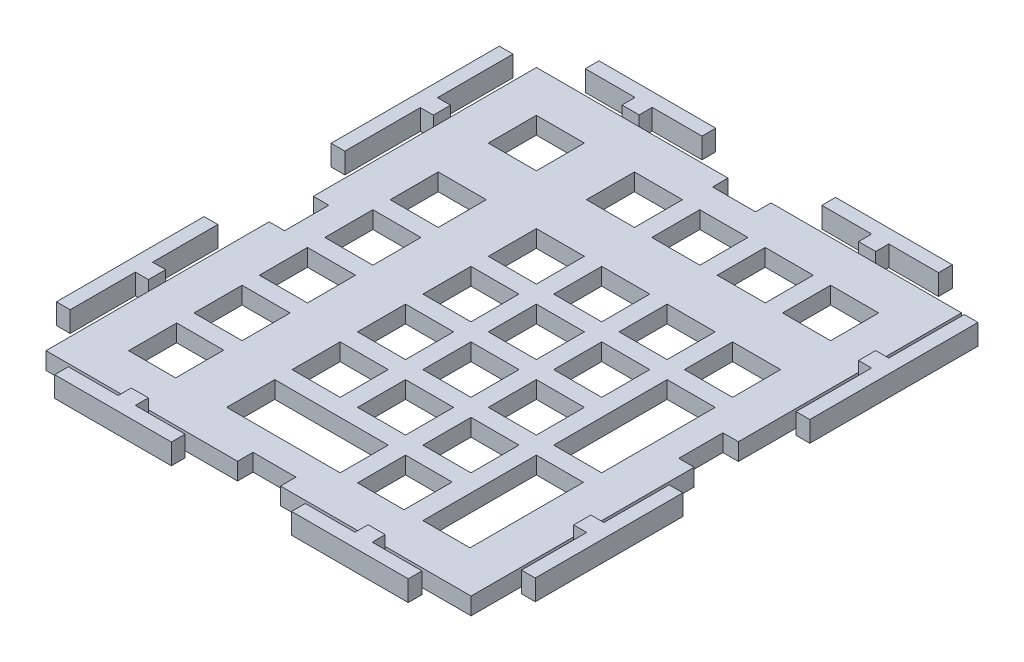
from build123d import *

# Parameters (mm, degrees)
SKETCH2_W           = 14
SKETCH2_H           = 14
SKETCH2_H_2         = 33.05
SKETCH2_W_2         = 13.729566143
SKETCH2_W_3         = 13.70712796
SKETCH2_W_4         = 33.05
SKETCH2_W_5         = 13.572021081
BOSS_EXTRUDE1_DEPTH = 5
SKETCH4_W           = 12.525
SKETCH4_H           = 4.5
SKETCH4_W_2         = 4.5
SKETCH4_H_2         = 12.875
CUT_EXTRUDE1_DEPTH  = 105.356725069
BOSS_EXTRUDE2_DEPTH = 3


with BuildPart() as part:
    # Sketch2 → Boss-Extrude1 (new body)
    with BuildSketch(Plane(origin=(0, 0, 0), x_dir=(1, 0, 0), z_dir=(0, 1, 0))):
        Polygon((-50.855969028, -62.044409949), (43.049030972, -62.044409949), (58.009030972, -62.044409949), (58.009030972, -47.084409949), (58.009030972, 65.870590051), (58.009030972, 80.830590051), (43.049030972, 80.830590051), (-50.855969028, 80.830590051), (-65.815969028, 80.830590051), (-65.815969028, 65.870590051), (-65.815969028, -47.084409949), (-65.815969028, -62.044409949), align=None)
        with Locations((38.959030972, 61.745590051)):
            Rectangle(SKETCH2_W, SKETCH2_H, mode=Mode.SUBTRACT)
        with Locations((19.909030972, 61.745590051)):
            Rectangle(SKETCH2_W, SKETCH2_H, mode=Mode.SUBTRACT)
        with Locations((0.859030972, 61.745590051)):
            Rectangle(SKETCH2_W, SKETCH2_H, mode=Mode.SUBTRACT)
        with Locations((-18.190969028, 61.745590051)):
            Rectangle(SKETCH2_W, SKETCH2_H, mode=Mode.SUBTRACT)
        with Locations((38.959030972, 33.170590051)):
            Rectangle(SKETCH2_W, SKETCH2_H, mode=Mode.SUBTRACT)
        with Locations((-46.765969028, 61.745590051)):
            Rectangle(SKETCH2_W, SKETCH2_H, mode=Mode.SUBTRACT)
        with Locations((19.909030972, 33.170590051)):
            Rectangle(SKETCH2_W, SKETCH2_H, mode=Mode.SUBTRACT)
        with Locations((0.859030972, 33.170590051)):
            Rectangle(SKETCH2_W, SKETCH2_H, mode=Mode.SUBTRACT)
        with Locations((-18.190969028, 33.170590051)):
            Rectangle(SKETCH2_W, SKETCH2_H, mode=Mode.SUBTRACT)
        with Locations((-46.765969028, 33.170590051)):
            Rectangle(SKETCH2_W, SKETCH2_H, mode=Mode.SUBTRACT)
        with Locations((38.959030972, 4.595590051)):
            Rectangle(SKETCH2_W, SKETCH2_H_2, mode=Mode.SUBTRACT)
        with Locations((19.909030972, 14.120590051)):
            Rectangle(SKETCH2_W, SKETCH2_H, mode=Mode.SUBTRACT)
        with Locations((0.859030972, 14.120590051)):
            Rectangle(SKETCH2_W, SKETCH2_H, mode=Mode.SUBTRACT)
        with Locations((-18.190969028, 14.120590051)):
            Rectangle(SKETCH2_W, SKETCH2_H, mode=Mode.SUBTRACT)
        with Locations((-46.765969028, 14.120590051)):
            Rectangle(SKETCH2_W, SKETCH2_H, mode=Mode.SUBTRACT)
        with Locations((19.909030972, -4.929409949)):
            Rectangle(SKETCH2_W, SKETCH2_H, mode=Mode.SUBTRACT)
        with Locations((0.859030972, -4.929409949)):
            Rectangle(SKETCH2_W, SKETCH2_H, mode=Mode.SUBTRACT)
        with Locations((-18.190969028, -4.929409949)):
            Rectangle(SKETCH2_W, SKETCH2_H, mode=Mode.SUBTRACT)
        with Locations((-46.765969028, -4.929409949)):
            Rectangle(SKETCH2_W, SKETCH2_H, mode=Mode.SUBTRACT)
        with Locations((38.823814044, -33.504409949)):
            Rectangle(SKETCH2_W_2, SKETCH2_H_2, mode=Mode.SUBTRACT)
        with Locations((19.909030972, -23.979409949)):
            Rectangle(SKETCH2_W, SKETCH2_H, mode=Mode.SUBTRACT)
        with Locations((0.859030972, -23.979409949)):
            Rectangle(SKETCH2_W, SKETCH2_H, mode=Mode.SUBTRACT)
        with Locations((-18.190969028, -23.979409949)):
            Rectangle(SKETCH2_W, SKETCH2_H, mode=Mode.SUBTRACT)
        with Locations((-46.765969028, -23.979409949)):
            Rectangle(SKETCH2_W, SKETCH2_H, mode=Mode.SUBTRACT)
        with Locations((-46.912405048, -43.029409949)):
            Rectangle(SKETCH2_W_3, SKETCH2_H, mode=Mode.SUBTRACT)
        with Locations((-8.665969028, -43.029409949)):
            Rectangle(SKETCH2_W_4, SKETCH2_H, mode=Mode.SUBTRACT)
        with Locations((19.695041513, -43.029409949)):
            Rectangle(SKETCH2_W_5, SKETCH2_H, mode=Mode.SUBTRACT)
    extrude(amount=BOSS_EXTRUDE1_DEPTH)

    # Sketch4 → Cut-Extrude1 (cut, through all)
    with BuildSketch(Plane(origin=(0, 5, 0), x_dir=(1, 0, 0), z_dir=(0, 1, 0))):
        with Locations((-3.753469028, 78.580590051)):
            Rectangle(SKETCH4_W, SKETCH4_H)
        with Locations((-3.753469028, -59.794409949)):
            Rectangle(SKETCH4_W, SKETCH4_H)
        with Locations((55.759030972, 9.393090051)):
            Rectangle(SKETCH4_W_2, SKETCH4_H_2)
        with Locations((-63.565969028, 9.393090051)):
            Rectangle(SKETCH4_W_2, SKETCH4_H_2)
    extrude(amount=-CUT_EXTRUDE1_DEPTH, mode=Mode.SUBTRACT)

    # Sketch5 → Boss-Extrude2 (add, symmetric)
    with BuildSketch(Plane(origin=(0, 5, 0), x_dir=(1, 0, 0), z_dir=(0, 1, 0))):
        Polygon((-35.89745853, 80.830590051), (-40.89745853, 80.830590051), (-40.89745853, 84.630590051), (-55.39745853, 84.630590051), (-55.39745853, 88.630590051), (-21.39745853, 88.630590051), (-21.39745853, 84.630590051), (-35.89745853, 84.630590051), align=None)
        Polygon((-69.615969028, 55.802202747), (-65.815969028, 55.802202747), (-65.815969028, 50.802202747), (-69.615969028, 50.802202747), (-69.615969028, 28.802202747), (-73.615969028, 28.802202747), (-73.615969028, 77.802202747), (-69.615969028, 77.802202747), align=None)
        Polygon((28.009030972, -62.044409949), (33.009030972, -62.044409949), (33.009030972, -65.844409949), (47.509030972, -65.844409949), (47.509030972, -69.844409949), (13.509030972, -69.844409949), (13.509030972, -65.844409949), (28.009030972, -65.844409949), align=None)
        Polygon((33.016786021, 84.630590051), (47.516786021, 84.630590051), (47.516786021, 88.630590051), (13.516786021, 88.630590051), (13.516786021, 84.630590051), (28.016786021, 84.630590051), (28.016786021, 80.830590051), (33.016786021, 80.830590051), align=None)
        Polygon((-35.990838499, -65.844409949), (-21.490838499, -65.844409949), (-21.490838499, -69.844409949), (-55.490838499, -69.844409949), (-55.490838499, -65.844409949), (-40.990838499, -65.844409949), (-40.990838499, -62.044409949), (-35.990838499, -62.044409949), align=None)
        Polygon((-65.815969028, -27.197797253), (-69.615969028, -27.197797253), (-69.615969028, -8.197797253), (-73.615969028, -8.197797253), (-73.615969028, -51.197797253), (-69.615969028, -51.197797253), (-69.615969028, -32.197797253), (-65.815969028, -32.197797253), align=None)
        Polygon((61.809030972, 55.830590051), (61.809030972, 77.830590051), (65.809030972, 77.830590051), (65.809030972, 28.830590051), (61.809030972, 28.830590051), (61.809030972, 50.830590051), (58.009030972, 50.830590051), (58.009030972, 55.830590051), align=None)
        Polygon((58.009030972, -27.144409949), (61.809030972, -27.144409949), (61.809030972, -8.144409949), (65.809030972, -8.144409949), (65.809030972, -51.144409949), (61.809030972, -51.144409949), (61.809030972, -32.144409949), (58.009030972, -32.144409949), align=None)
    extrude(amount=BOSS_EXTRUDE2_DEPTH, both=True)


solid = part.part
